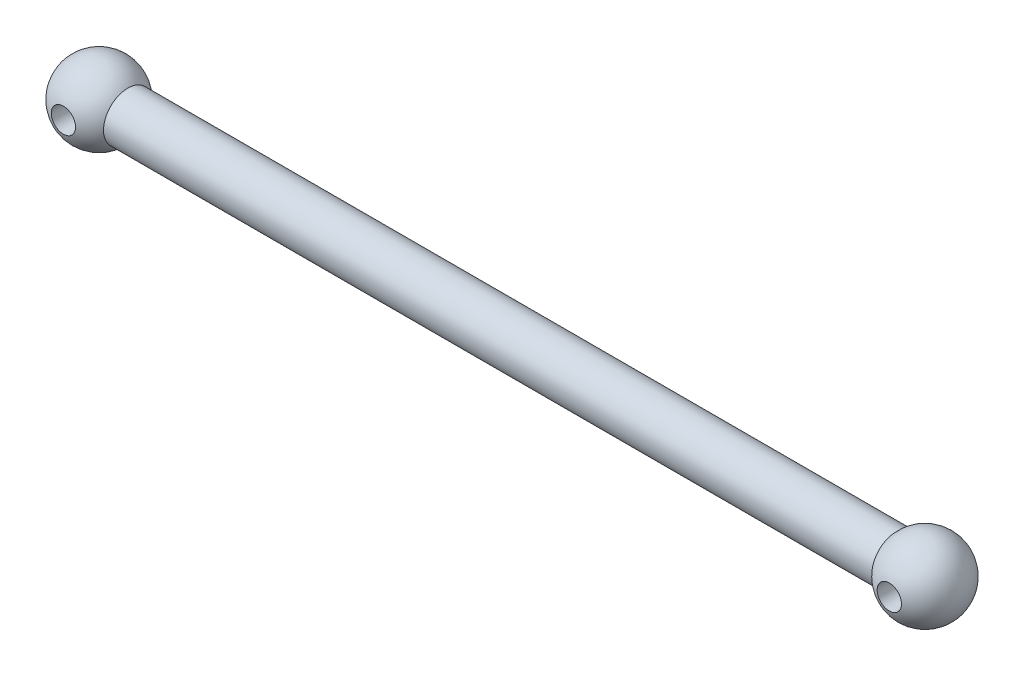
from build123d import *

# Parameters (mm, degrees)
CUT_EXTRUDE1_DEPTH      = 38.358131645
CUT_EXTRUDE1_DEPTH_BACK = 38.358131645
SKETCH2_R               = 1


with BuildPart() as part:
    # Sketch1 → Revolve2 (revolve)
    with BuildSketch(Plane(origin=(0, 0, 0), x_dir=(1, 0, 0), z_dir=(0, 1, 0))):
        with BuildLine():
            ThreePointArc((-37.1, 0), (-35.06478027, -2.911398801), (-31.631456144, -2))
            Line((-31.631456144, -2), (31.631456144, -2))
            ThreePointArc((31.631456144, -2), (35.06478027, -2.911398801), (37.1, 0))
            Line((37.1, 0), (-37.1, 0))
        make_face()
    revolve(axis=Axis((-34, 0, 0), (1, 0, 0)))

    # Sketch2 → Cut-Extrude1 (cut, two sides: drawn at the far end of the back side and taken through both)
    with BuildSketch(Plane.XY.offset(-CUT_EXTRUDE1_DEPTH_BACK)):
        with Locations((34, 0)):
            Circle(SKETCH2_R)
        with Locations((-34, 0)):
            Circle(SKETCH2_R)
    extrude(amount=CUT_EXTRUDE1_DEPTH + CUT_EXTRUDE1_DEPTH_BACK, mode=Mode.SUBTRACT)


solid = part.part
